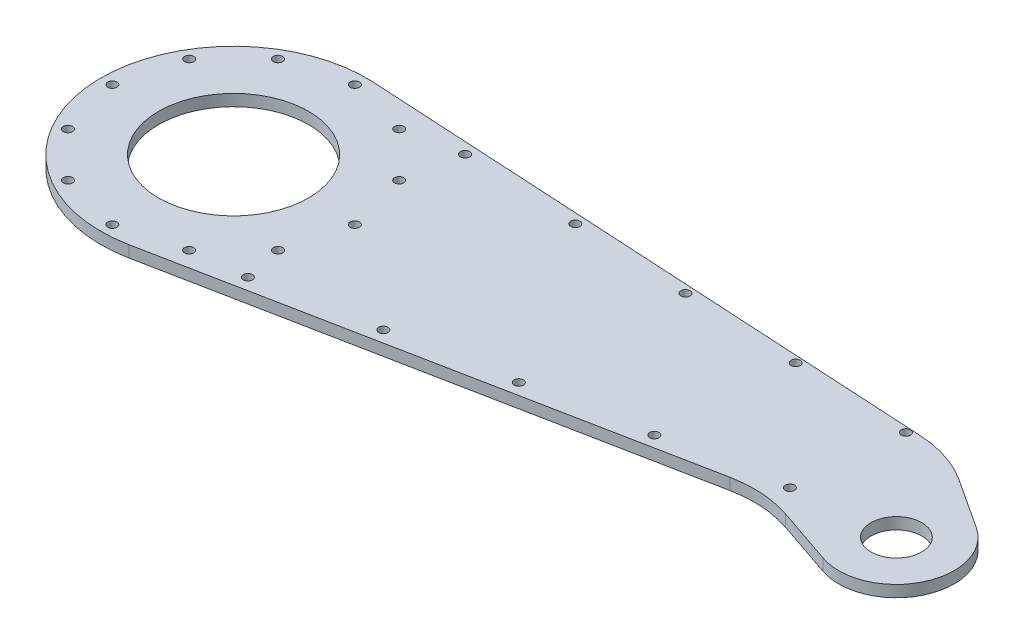
from build123d import *

# Parameters (mm, degrees)
SKETCH1_R           = 11
SKETCH1_R_2         = 32.5
BOSS_EXTRUDE2_DEPTH = 5
FILLET1_R           = 50
SKETCH2_R           = 2
CUT_EXTRUDE1_DEPTH  = 10


with BuildPart() as part:
    # Sketch1 → Boss-Extrude2 (new body)
    with BuildSketch(Plane(origin=(0, 0, 0), x_dir=(1, 0, 0), z_dir=(0, 1, 0))):
        with BuildLine():
            Line((267.665847291, 42.543408284), (3.227383684, 57.409354591))
            ThreePointArc((3.227383684, 57.409354591), (-57.36165087, -3.9863529), (11.137344414, -56.411076567))
            Line((11.137344414, -56.411076567), (241.562645652, -10.917778127))
            Line((241.562645652, -10.917778127), (278.930297787, -23.661781552))
            ThreePointArc((278.930297787, -23.661781552), (309.465140568, -10.968931546), (300.695510241, 20.914898978))
            Line((300.695510241, 20.914898978), (267.665847291, 42.543408284))
        make_face()
        with Locations((287, 0)):
            Circle(SKETCH1_R, mode=Mode.SUBTRACT)
        Circle(SKETCH1_R_2, mode=Mode.SUBTRACT)
    extrude(amount=BOSS_EXTRUDE2_DEPTH)

    # Fillet1
    fillet1_edges = [part.edges().sort_by_distance(p)[0] for p in [
        (241.562645652, 2.5, 10.917778127),
        (267.665847291, 2.5, -42.543408284),
    ]]
    fillet(fillet1_edges, radius=FILLET1_R)

    # Sketch2 → Cut-Extrude1 (cut)
    with BuildSketch(Plane(origin=(0, 5, 0), x_dir=(1, 0, 0), z_dir=(0, 1, 0))):
        with Locations((0, 52.5)):
            Circle(SKETCH2_R)
        with Locations((26.25, 45.466333699)):
            Circle(SKETCH2_R)
        with Locations((45.466333699, 26.25)):
            Circle(SKETCH2_R)
        with Locations((52.5, 0)):
            Circle(SKETCH2_R)
        with Locations((45.466333699, -26.25)):
            Circle(SKETCH2_R)
        with Locations((26.25, -45.466333699)):
            Circle(SKETCH2_R)
        with Locations((0, -52.5)):
            Circle(SKETCH2_R)
        with Locations((-26.25, -45.466333699)):
            Circle(SKETCH2_R)
        with Locations((-45.466333699, -26.25)):
            Circle(SKETCH2_R)
        with Locations((-52.5, 0)):
            Circle(SKETCH2_R)
        with Locations((-45.466333699, 26.25)):
            Circle(SKETCH2_R)
        with Locations((-26.25, 45.466333699)):
            Circle(SKETCH2_R)
        with Locations((49.950450955, 50.274590067)):
            Circle(SKETCH2_R)
        with Locations((99.90090191, 48.049180133)):
            Circle(SKETCH2_R)
        with Locations((149.851352866, 45.8237702)):
            Circle(SKETCH2_R)
        with Locations((199.801803821, 43.598360267)):
            Circle(SKETCH2_R)
        with Locations((249.752254776, 41.372950334)):
            Circle(SKETCH2_R)
        with Locations((49.068669705, -42.894498796)):
            Circle(SKETCH2_R)
        with Locations((98.13733941, -33.288997592)):
            Circle(SKETCH2_R)
        with Locations((147.206009115, -23.683496388)):
            Circle(SKETCH2_R)
        with Locations((196.27467882, -14.077995184)):
            Circle(SKETCH2_R)
        with Locations((245.343348525, -4.47249398)):
            Circle(SKETCH2_R)
    extrude(amount=-CUT_EXTRUDE1_DEPTH, mode=Mode.SUBTRACT)


solid = part.part
